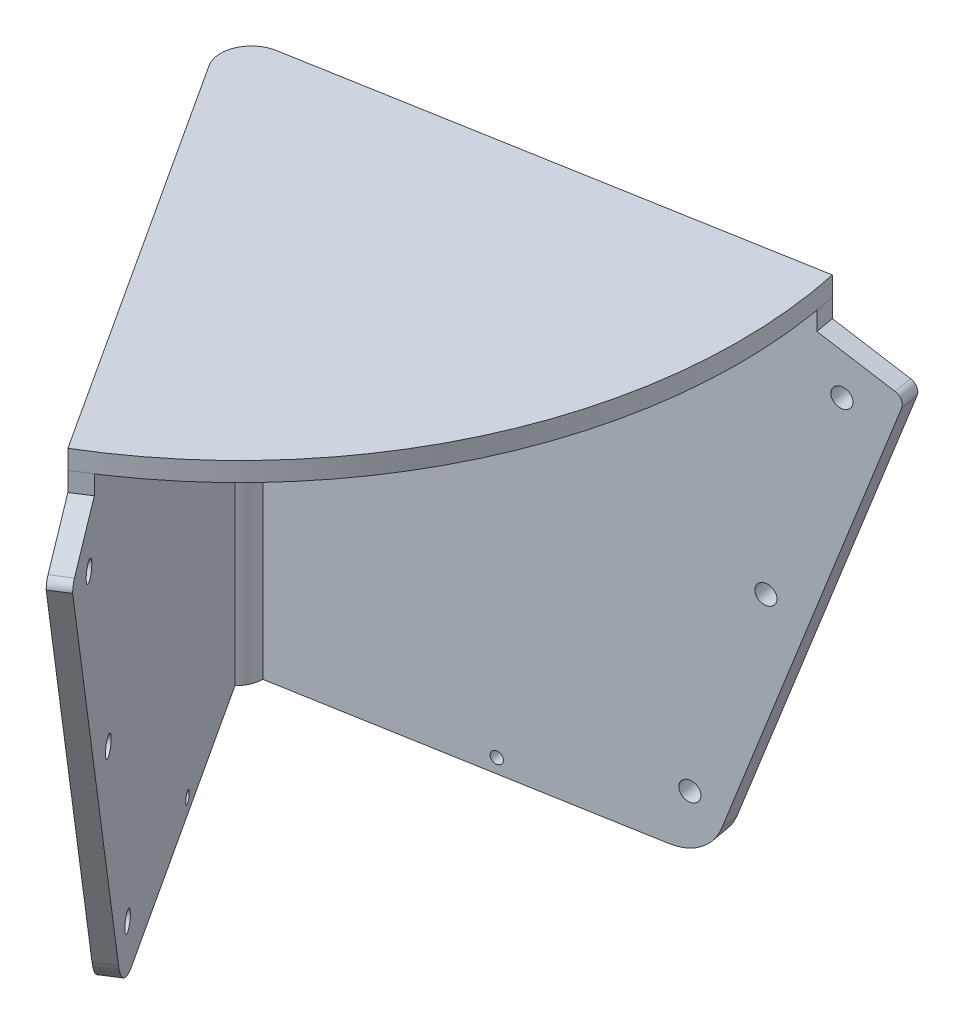
from build123d import *

# Parameters (mm, degrees)
SKETCH1_R           = 0.5
SKETCH1_R_2         = 0.3
BOSS_EXTRUDE2_DEPTH = 1
BOSS_EXTRUDE3_DEPTH = 26.85
SKETCH3_R           = 0.3
SKETCH3_R_2         = 0.5
BOSS_EXTRUDE4_DEPTH = 1
BOSS_EXTRUDE5_DEPTH = 1


with BuildPart() as part:
    # Sketch1 → Boss-Extrude2 (new body)
    with BuildSketch(Plane(origin=(3.159090075, 0, 17.916090109), x_dir=(-0.9848077530122081, 0, 0.17364817766693075), z_dir=(-0.17364817766693075, 0, -0.9848077530122081))):
        with BuildLine():
            Line((72.595007279, -13.558180283), (90.945658345, -13.558180283))
            Line((90.945658345, -13.558180283), (90.945658345, 13.327413467))
            Line((90.945658345, 13.327413467), (65.945658345, 13.327413467))
            Line((65.945658345, 13.327413467), (65.945658345, 12.327413467))
            Line((65.945658345, 12.327413467), (62.421811017, 11.044837929))
            ThreePointArc((62.421811017, 11.044837929), (62.139667195, 10.78630075), (62.122974779, 10.403981547))
            Line((62.122974779, 10.403981547), (70.245775727, -11.913230641))
            ThreePointArc((70.245775727, -11.913230641), (71.161066188, -13.106060393), (72.595007279, -13.558180283))
        make_face()
        with Locations((71.67696085, -10.802896266)):
            Circle(SKETCH1_R, mode=Mode.SUBTRACT)
        with Locations((68.24645728, -0.507107991)):
            Circle(SKETCH1_R, mode=Mode.SUBTRACT)
        with Locations((80.389671463, -12.820376082)):
            Circle(SKETCH1_R_2, mode=Mode.SUBTRACT)
        with Locations((64.81595371, 9.788680284)):
            Circle(SKETCH1_R, mode=Mode.SUBTRACT)
    extrude(amount=BOSS_EXTRUDE2_DEPTH)



with BuildPart() as body_2:
    # Sketch2 → Boss-Extrude3 (new body)
    with BuildSketch(Plane(origin=(0, -13.558180283, 0), x_dir=(-1, 0, 0), z_dir=(0, -1, 0))):
        with BuildLine():
            Line((86.404899366, -33.708637947), (86.404899366, -32.708637947))
            ThreePointArc((86.404899366, -32.708637947), (87.857024455, -33.679090764), (87.576421786, -35.402955053))
            Line((87.576421786, -35.402955053), (86.845068084, -34.720956693))
            ThreePointArc((86.845068084, -34.720956693), (86.519702424, -34.260574933), (86.404899366, -33.708637947))
        make_face()
    extrude(amount=-BOSS_EXTRUDE3_DEPTH)

    # Sketch3 → Boss-Extrude4 (add)
    with BuildSketch(Plane(origin=(-76.943655908, 0, 49.967794395), x_dir=(0.5446390350150253, 0, 0.8386705679454252), z_dir=(-0.8386705679454252, 0, 0.5446390350150253))):
        with BuildLine():
            Line((-18.179769608, -13.558180283), (0.170881459, -13.558180283))
            ThreePointArc((0.170881459, -13.558180283), (1.604822549, -13.106060393), (2.520113011, -11.913230641))
            Line((2.520113011, -11.913230641), (10.673067649, 10.574991619))
            ThreePointArc((10.673067649, 10.574991619), (10.582643671, 10.861779837), (10.34407772, 11.044837929))
            Line((10.34407772, 11.044837929), (6.820230392, 12.327413467))
            Line((6.820230392, 12.327413467), (6.820230392, 13.327413467))
            Line((6.820230392, 13.327413467), (5.820230392, 13.327413467))
            Line((5.820230392, 13.327413467), (-18.179769608, 13.291819717))
            Line((-18.179769608, 13.291819717), (-18.179769608, -13.558180283))
        make_face()
        with Locations((-9.737882362, -12.779880795)):
            Circle(SKETCH3_R, mode=Mode.SUBTRACT)
        with Locations((0.908433977, -11.02066571)):
            Circle(SKETCH3_R_2, mode=Mode.SUBTRACT)
        with Locations((4.338937547, -0.724877435)):
            Circle(SKETCH3_R_2, mode=Mode.SUBTRACT)
        with Locations((7.769441116, 9.57091084)):
            Circle(SKETCH3_R_2, mode=Mode.SUBTRACT)
    extrude(amount=BOSS_EXTRUDE4_DEPTH)


with BuildPart() as part_1:
    add(part.part)

    add(body_2.part)  # Boss-Extrude5 merges body 2
    # Sketch4 → Boss-Extrude5 (add)
    with BuildSketch(Plane(origin=(-0.010758081, 13.318752346, -0.016565992), x_dir=(0.9999996737792014, 0.000807737879258443, -1.0046721206054947e-06), z_dir=(-0.0008077385040686106, 0.9999989002492029, -0.0012438082223392628))):
        with BuildLine():
            Line((-74.057030053, -56.248893181), (-87.649206222, -35.318754298))
            ThreePointArc((-87.649206222, -35.318754298), (-87.854314972, -33.716757421), (-86.56778712, -32.740381633))
            Line((-86.56778712, -32.740381633), (-61.947596965, -28.39918055))
            ThreePointArc((-61.947596965, -28.39918055), (-63.536537082, -44.265817075), (-74.057030053, -56.248893181))
        make_face()
    extrude(amount=BOSS_EXTRUDE5_DEPTH)


solid = part_1.part
